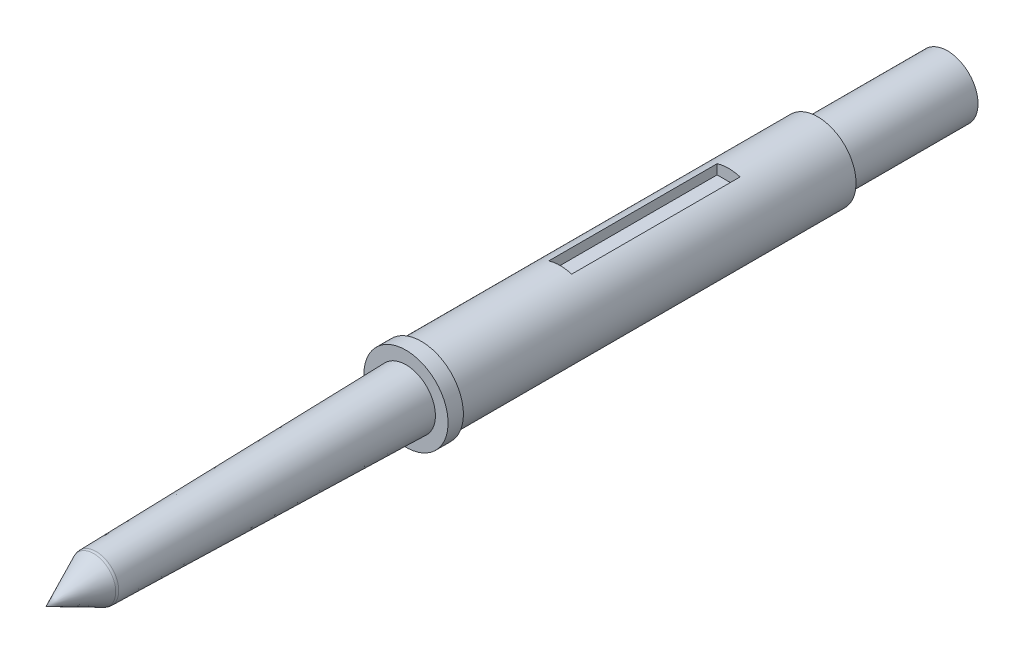
from build123d import *

# Parameters (mm, degrees)
SKETCH4_W          = 4.7625
SKETCH4_H          = 34.925
CUT_EXTRUDE1_DEPTH = 2.38125


with BuildPart() as part:
    # Sketch3 → Revolve2 (revolve)
    with BuildSketch(Plane(origin=(0, 0, 0), x_dir=(0, 0, -1), z_dir=(1, 0, 0))):
        with BuildLine():
            Line((-186.95544175, 0), (-177.8, 0))
            Line((-177.8, 0), (0, 0))
            Line((0, 0), (0, 6.35))
            Line((0, 6.35), (-26.8925, 6.35))
            Line((-26.8925, 6.35), (-26.8925, 7.9375))
            Line((-26.8925, 7.9375), (-109.125, 7.9375))
            Line((-109.125, 7.9375), (-109.125, 8.73125))
            Line((-109.125, 8.73125), (-112.3, 8.73125))
            Line((-112.3, 8.73125), (-112.3, 6.109884817))
            Line((-112.3, 6.109884817), (-176.558072773, 4.689142192))
            ThreePointArc((-176.558072773, 4.689142192), (-176.816471065, 4.656721397), (-177.062823544, 4.572274718))
            Line((-177.062823544, 4.572274718), (-186.95544175, 0))
        make_face()
    revolve(axis=Axis((0, 0, 0), (0, 0, 1)))

    # Sketch4 → Cut-Extrude1 (cut)
    with BuildSketch(Plane(origin=(0, 7.9375, 0), x_dir=(1, 0, 0), z_dir=(0, 1, 0))):
        with Locations((0, -62.855066403)):
            Rectangle(SKETCH4_W, SKETCH4_H)
    extrude(amount=-CUT_EXTRUDE1_DEPTH, mode=Mode.SUBTRACT)


solid = part.part
